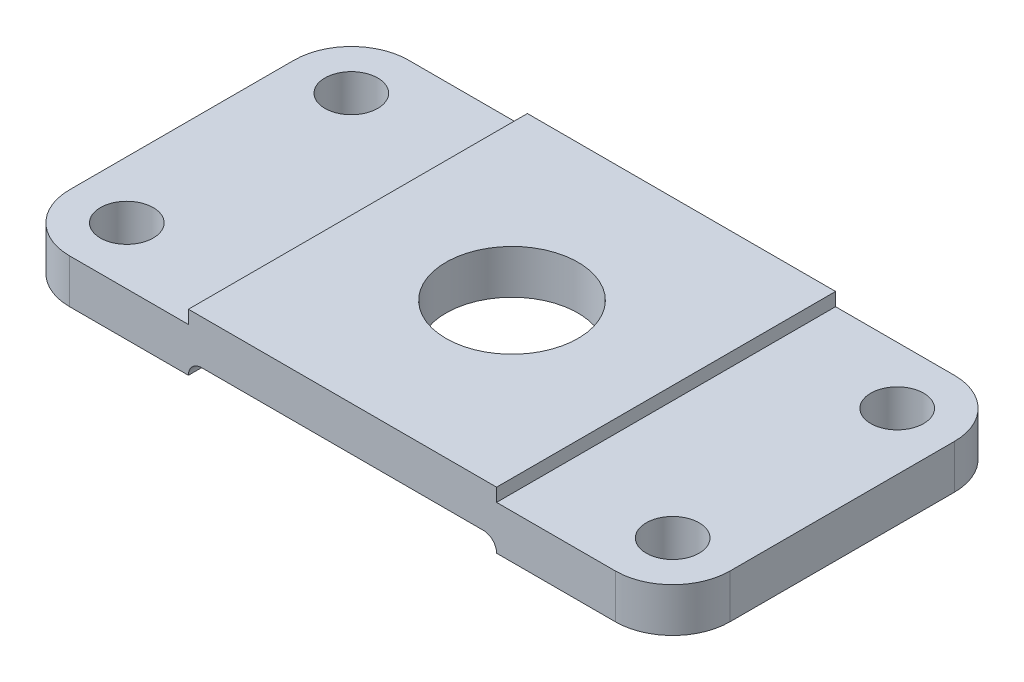
from build123d import *

# Parameters (mm, degrees)
EXTRUDE_2_DEPTH          = 13
CUT_EXTRUDE_2_DEPTH      = 86.300937861
CUT_EXTRUDE_2_DEPTH_BACK = 86.300937861
SKETCH_2_R               = 6
SKETCH_2_R_2             = 15
SKETCH_3_W               = 100
SKETCH_3_H               = 100
CUT_EXTRUDE_3_DEPTH      = 3
SKETCH_4_W               = 70
SKETCH_4_H               = 77
CUT_EXTRUDE_4_DEPTH      = 3
FILLET_1_R               = 3


with BuildPart() as part:
    # 스케치1 → 보스-돌출2 (new body)
    with BuildSketch(Plane(origin=(0, 0, 0), x_dir=(1, 0, 0), z_dir=(0, 1, 0))):
        with BuildLine():
            Line((-62, 38.5), (62, 38.5))
            ThreePointArc((62, 38.5), (71.192388155, 34.692388155), (75, 25.5))
            Line((75, 25.5), (75, -25.5))
            ThreePointArc((75, -25.5), (71.192388155, -34.692388155), (62, -38.5))
            Line((62, -38.5), (-62, -38.5))
            ThreePointArc((-62, -38.5), (-71.192388155, -34.692388155), (-75, -25.5))
            Line((-75, -25.5), (-75, 25.5))
            ThreePointArc((-75, 25.5), (-71.192388155, 34.692388155), (-62, 38.5))
        make_face()
    extrude(amount=EXTRUDE_2_DEPTH)

    # 스케치2 → 컷-돌출2 (cut, two sides: drawn at the far end of the back side and taken through both)
    with BuildSketch(Plane(origin=(0, 0, 0), x_dir=(1, 0, 0), z_dir=(0, 1, 0)).offset(-CUT_EXTRUDE_2_DEPTH_BACK)):
        with Locations(Location((-62, 25.5, 0), (0, 0, 270))):
            Circle(SKETCH_2_R)
        with Locations(Location((-62, -25.5, 0), (0, 0, 270))):
            Circle(SKETCH_2_R)
        with Locations(Location((62, -25.5, 0), (0, 0, 270))):
            Circle(SKETCH_2_R)
        with Locations(Location((62, 25.5, 0), (0, 0, 270))):
            Circle(SKETCH_2_R)
        with Locations(Location((0, 0, 0), (0, 0, 270))):
            Circle(SKETCH_2_R_2)
    extrude(amount=CUT_EXTRUDE_2_DEPTH + CUT_EXTRUDE_2_DEPTH_BACK, mode=Mode.SUBTRACT)

    # 스케치3 → 컷-돌출3 (cut)
    with BuildSketch(Plane(origin=(0, 13, 0), x_dir=(1, 0, 0), z_dir=(0, 1, 0))):
        with Locations((85, 0)):
            Rectangle(SKETCH_3_W, SKETCH_3_H)
        with Locations((-85, 0)):
            Rectangle(SKETCH_3_W, SKETCH_3_H)
    extrude(amount=-CUT_EXTRUDE_3_DEPTH, mode=Mode.SUBTRACT)

    # 스케치4 → 컷-돌출4 (cut)
    with BuildSketch(Plane.XZ):
        Rectangle(SKETCH_4_W, SKETCH_4_H)
    extrude(amount=-CUT_EXTRUDE_4_DEPTH, mode=Mode.SUBTRACT)

    # 필렛1
    fillet_1_edges = [part.edges().sort_by_distance(p)[0] for p in [
        (-35, 3, 0),
        (35, 3, 0),
    ]]
    fillet(fillet_1_edges, radius=FILLET_1_R - 0.0001)  # a hair under: the kernel refuses the full size


solid = part.part
